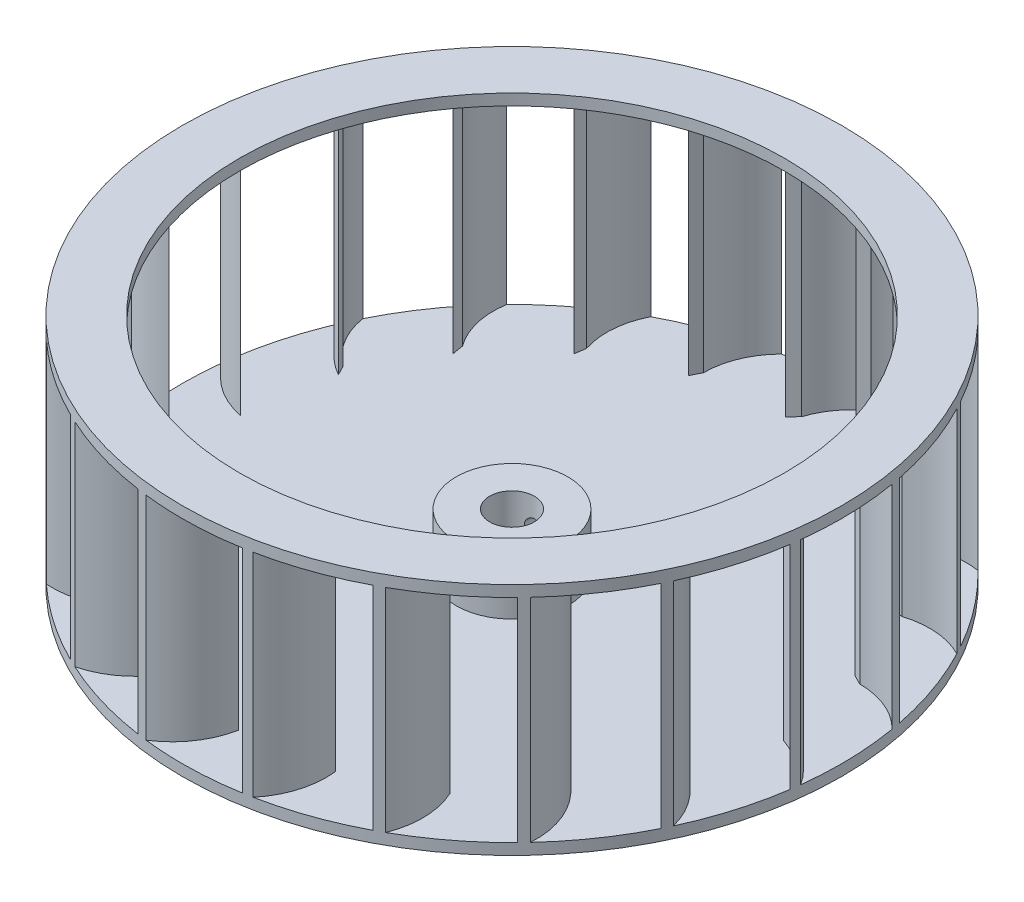
from build123d import *

# Parameters (mm, degrees)
SKETCH2_R           = 59
BOSS_EXTRUDE1_DEPTH = 2
BOSS_EXTRUDE2_DEPTH = 38
SKETCH4_R           = 59
SKETCH4_R_2         = 48.802353881
BOSS_EXTRUDE3_DEPTH = 2
SKETCH5_R           = 10
SKETCH5_R_2         = 4
BOSS_EXTRUDE4_DEPTH = 10
SKETCH6_R           = 1.5
CUT_EXTRUDE1_DEPTH  = 25
SKETCH7_R           = 4
CUT_EXTRUDE2_DEPTH  = 93.531075861


with BuildPart() as part:
    # Sketch2 → Boss-Extrude1 (new body)
    with BuildSketch(Plane(origin=(0, 0, 0), x_dir=(1, 0, 0), z_dir=(0, 1, 0))):
        Circle(SKETCH2_R)
    extrude(amount=BOSS_EXTRUDE1_DEPTH)

    # Sketch3 → Boss-Extrude2 (add)
    with BuildSketch(Plane(origin=(0, 2, 0), x_dir=(1, 0, 0), z_dir=(0, 1, 0))):
        with BuildLine():
            Line((-14.892857143, 46.474428995), (-14, 48.26406754))
            ThreePointArc((-14, 48.26406754), (-12.934313455, 53.621635593), (-9.899494937, 58.163562477))
            ThreePointArc((-9.899494937, 58.163562477), (-10.714001991, 58.019049986), (-11.526402854, 57.863131934))
            ThreePointArc((-11.526402854, 57.863131934), (-14.384712835, 52.516130174), (-14.892857143, 46.474428995))
        make_face()
        with BuildLine():
            Line((0.197439531, 48.801954489), (1.599625859, 50.228093858))
            ThreePointArc((1.599625859, 50.228093858), (4.268733569, 54.994128614), (8.558550091, 58.375947276))
            ThreePointArc((8.558550091, 58.375947276), (7.739251034, 58.490204252), (6.918430571, 58.592963045))
            ThreePointArc((6.918430571, 58.592963045), (2.547701825, 54.390928538), (0.197439531, 48.801954489))
        make_face()
        with BuildLine():
            Line((15.268409449, 46.352404654), (17.042669195, 47.27544439))
            ThreePointArc((17.042669195, 47.27544439), (21.05392721, 50.983413159), (26.178824605, 52.874087626))
            ThreePointArc((26.178824605, 52.874087626), (25.434932246, 53.2359298), (24.686039809, 53.587306692))
            ThreePointArc((24.686039809, 53.587306692), (19.230729681, 50.941563853), (15.268409449, 46.352404654))
        make_face()
        with BuildLine():
            Line((28.844801068, 39.365558495), (30.817457326, 39.695145037))
            ThreePointArc((30.817457326, 39.695145037), (35.778215764, 41.982086001), (41.236533368, 42.196543884))
            ThreePointArc((41.236533368, 42.196543884), (40.640865073, 42.770551623), (40.037207473, 43.336151396))
            ThreePointArc((40.037207473, 43.336151396), (34.031319726, 42.505683967), (28.844801068, 39.365558495))
        make_face()
        with BuildLine():
            Line((39.597662585, 28.525337195), (41.575618016, 28.229208316))
            ThreePointArc((41.575618016, 28.229208316), (47.000283277, 28.87125976), (52.257722933, 27.388508426))
            ThreePointArc((52.257722933, 27.388508426), (51.868586866, 28.118493853), (51.469254313, 28.842951659))
            ThreePointArc((51.469254313, 28.842951659), (45.500687087, 29.90905158), (39.597662585, 28.525337195))
        make_face()
        with BuildLine():
            Line((46.474428995, 14.892857143), (48.26406754, 14))
            ThreePointArc((48.26406754, 14), (53.621635593, 12.934313455), (58.163562477, 9.899494937))
            ThreePointArc((58.163562477, 9.899494937), (58.019049986, 10.714001991), (57.863131934, 11.526402854))
            ThreePointArc((57.863131934, 11.526402854), (52.516130174, 14.384712835), (46.474428995, 14.892857143))
        make_face()
        with BuildLine():
            Line((48.801954489, -0.197439531), (50.228093858, -1.599625859))
            ThreePointArc((50.228093858, -1.599625859), (54.994128614, -4.268733569), (58.375947276, -8.558550091))
            ThreePointArc((58.375947276, -8.558550091), (58.490204252, -7.739251034), (58.592963045, -6.918430571))
            ThreePointArc((58.592963045, -6.918430571), (54.390928538, -2.547701825), (48.801954489, -0.197439531))
        make_face()
        with BuildLine():
            Line((46.352404654, -15.268409449), (47.27544439, -17.042669195))
            ThreePointArc((47.27544439, -17.042669195), (50.983413159, -21.05392721), (52.874087626, -26.178824605))
            ThreePointArc((52.874087626, -26.178824605), (53.2359298, -25.434932246), (53.587306692, -24.686039809))
            ThreePointArc((53.587306692, -24.686039809), (50.941563853, -19.230729681), (46.352404654, -15.268409449))
        make_face()
        with BuildLine():
            Line((39.365558495, -28.844801068), (39.695145037, -30.817457326))
            ThreePointArc((39.695145037, -30.817457326), (41.982086001, -35.778215764), (42.196543884, -41.236533368))
            ThreePointArc((42.196543884, -41.236533368), (42.770551623, -40.640865073), (43.336151396, -40.037207473))
            ThreePointArc((43.336151396, -40.037207473), (42.505683967, -34.031319726), (39.365558495, -28.844801068))
        make_face()
        with BuildLine():
            Line((28.525337195, -39.597662585), (28.229208316, -41.575618016))
            ThreePointArc((28.229208316, -41.575618016), (28.87125976, -47.000283277), (27.388508426, -52.257722933))
            ThreePointArc((27.388508426, -52.257722933), (28.118493853, -51.868586866), (28.842951659, -51.469254313))
            ThreePointArc((28.842951659, -51.469254313), (29.90905158, -45.500687087), (28.525337195, -39.597662585))
        make_face()
        with BuildLine():
            Line((14.892857143, -46.474428995), (14, -48.26406754))
            ThreePointArc((14, -48.26406754), (12.934313455, -53.621635593), (9.899494937, -58.163562477))
            ThreePointArc((9.899494937, -58.163562477), (10.714001991, -58.019049986), (11.526402854, -57.863131934))
            ThreePointArc((11.526402854, -57.863131934), (14.384712835, -52.516130174), (14.892857143, -46.474428995))
        make_face()
        with BuildLine():
            Line((-0.197439531, -48.801954489), (-1.599625859, -50.228093858))
            ThreePointArc((-1.599625859, -50.228093858), (-4.268733569, -54.994128614), (-8.558550091, -58.375947276))
            ThreePointArc((-8.558550091, -58.375947276), (-7.739251034, -58.490204252), (-6.918430571, -58.592963045))
            ThreePointArc((-6.918430571, -58.592963045), (-2.547701825, -54.390928538), (-0.197439531, -48.801954489))
        make_face()
        with BuildLine():
            Line((-15.268409449, -46.352404654), (-17.042669195, -47.27544439))
            ThreePointArc((-17.042669195, -47.27544439), (-21.05392721, -50.983413159), (-26.178824605, -52.874087626))
            ThreePointArc((-26.178824605, -52.874087626), (-25.434932246, -53.2359298), (-24.686039809, -53.587306692))
            ThreePointArc((-24.686039809, -53.587306692), (-19.230729681, -50.941563853), (-15.268409449, -46.352404654))
        make_face()
        with BuildLine():
            Line((-28.844801068, -39.365558495), (-30.817457326, -39.695145037))
            ThreePointArc((-30.817457326, -39.695145037), (-35.778215764, -41.982086001), (-41.236533368, -42.196543884))
            ThreePointArc((-41.236533368, -42.196543884), (-40.640865073, -42.770551623), (-40.037207473, -43.336151396))
            ThreePointArc((-40.037207473, -43.336151396), (-34.031319726, -42.505683967), (-28.844801068, -39.365558495))
        make_face()
        with BuildLine():
            Line((-39.597662585, -28.525337195), (-41.575618016, -28.229208316))
            ThreePointArc((-41.575618016, -28.229208316), (-47.000283277, -28.87125976), (-52.257722933, -27.388508426))
            ThreePointArc((-52.257722933, -27.388508426), (-51.868586866, -28.118493853), (-51.469254313, -28.842951659))
            ThreePointArc((-51.469254313, -28.842951659), (-45.500687087, -29.90905158), (-39.597662585, -28.525337195))
        make_face()
        with BuildLine():
            Line((-46.474428995, -14.892857143), (-48.26406754, -14))
            ThreePointArc((-48.26406754, -14), (-53.621635593, -12.934313455), (-58.163562477, -9.899494937))
            ThreePointArc((-58.163562477, -9.899494937), (-58.019049986, -10.714001991), (-57.863131934, -11.526402854))
            ThreePointArc((-57.863131934, -11.526402854), (-52.516130174, -14.384712835), (-46.474428995, -14.892857143))
        make_face()
        with BuildLine():
            Line((-48.801954489, 0.197439531), (-50.228093858, 1.599625859))
            ThreePointArc((-50.228093858, 1.599625859), (-54.994128614, 4.268733569), (-58.375947276, 8.558550091))
            ThreePointArc((-58.375947276, 8.558550091), (-58.490204252, 7.739251034), (-58.592963045, 6.918430571))
            ThreePointArc((-58.592963045, 6.918430571), (-54.390928538, 2.547701825), (-48.801954489, 0.197439531))
        make_face()
        with BuildLine():
            Line((-46.352404654, 15.268409449), (-47.27544439, 17.042669195))
            ThreePointArc((-47.27544439, 17.042669195), (-50.983413159, 21.05392721), (-52.874087626, 26.178824605))
            ThreePointArc((-52.874087626, 26.178824605), (-53.2359298, 25.434932246), (-53.587306692, 24.686039809))
            ThreePointArc((-53.587306692, 24.686039809), (-50.941563853, 19.230729681), (-46.352404654, 15.268409449))
        make_face()
        with BuildLine():
            Line((-39.365558495, 28.844801068), (-39.695145037, 30.817457326))
            ThreePointArc((-39.695145037, 30.817457326), (-41.982086001, 35.778215764), (-42.196543884, 41.236533368))
            ThreePointArc((-42.196543884, 41.236533368), (-42.770551623, 40.640865073), (-43.336151396, 40.037207473))
            ThreePointArc((-43.336151396, 40.037207473), (-42.505683967, 34.031319726), (-39.365558495, 28.844801068))
        make_face()
        with BuildLine():
            Line((-28.525337195, 39.597662585), (-28.229208316, 41.575618016))
            ThreePointArc((-28.229208316, 41.575618016), (-28.87125976, 47.000283277), (-27.388508426, 52.257722933))
            ThreePointArc((-27.388508426, 52.257722933), (-28.118493853, 51.868586866), (-28.842951659, 51.469254313))
            ThreePointArc((-28.842951659, 51.469254313), (-29.90905158, 45.500687087), (-28.525337195, 39.597662585))
        make_face()
    extrude(amount=BOSS_EXTRUDE2_DEPTH)

    # Sketch4 → Boss-Extrude3 (add)
    with BuildSketch(Plane(origin=(0, 40, 0), x_dir=(1, 0, 0), z_dir=(0, 1, 0))):
        Circle(SKETCH4_R)
        Circle(SKETCH4_R_2, mode=Mode.SUBTRACT)
    extrude(amount=BOSS_EXTRUDE3_DEPTH)

    # Sketch5 → Boss-Extrude4 (add)
    with BuildSketch(Plane(origin=(0, 2, 0), x_dir=(1, 0, 0), z_dir=(0, 1, 0))):
        Circle(SKETCH5_R)
        Circle(SKETCH5_R_2, mode=Mode.SUBTRACT)
    extrude(amount=BOSS_EXTRUDE4_DEPTH)

    # Sketch6 → Cut-Extrude1 (cut)
    with BuildSketch(Plane.XY):
        with Locations((0, 7)):
            Circle(SKETCH6_R)
    extrude(amount=-CUT_EXTRUDE1_DEPTH, mode=Mode.SUBTRACT)

    # Sketch7 → Cut-Extrude2 (cut, through all)
    with BuildSketch(Plane(origin=(0, 2, 0), x_dir=(1, 0, 0), z_dir=(0, 1, 0))):
        Circle(SKETCH7_R)
    extrude(amount=-CUT_EXTRUDE2_DEPTH, mode=Mode.SUBTRACT)


solid = part.part
